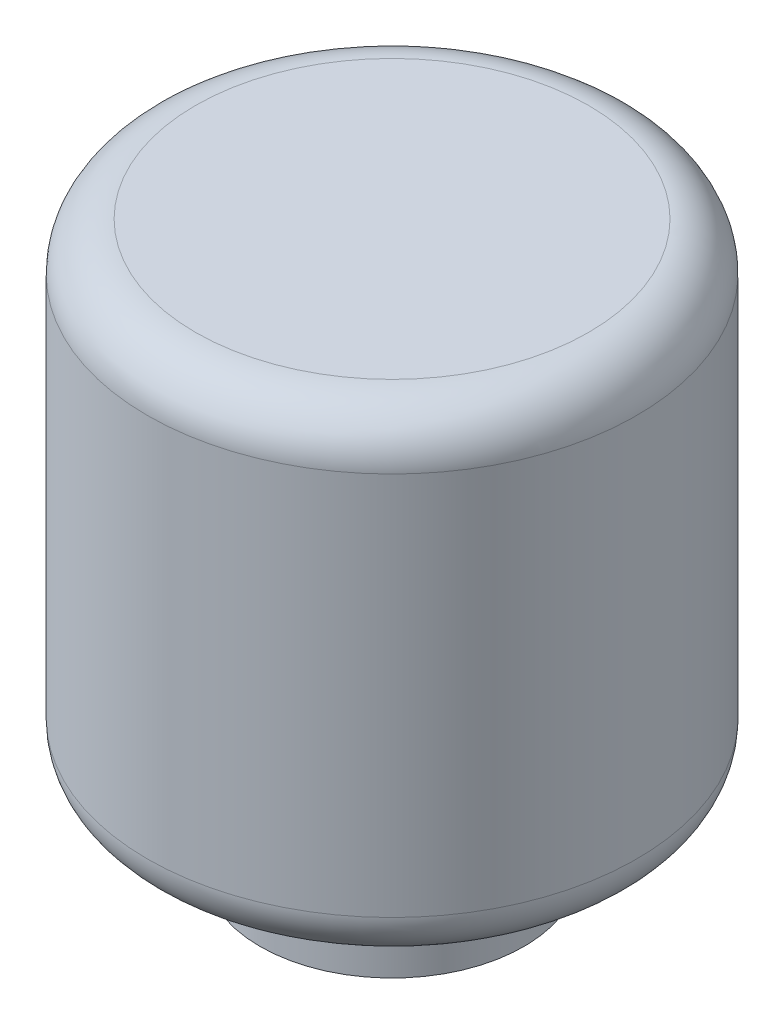
from build123d import *

# Parameters (mm, degrees)
SKETCH_1_R      = 5.5
EXTRUDE_1_DEPTH = 1.5
SKETCH_2_R      = 2.5
EXTRUDE_2_DEPTH = 2
SKETCH_3_R      = 10.188778254
EXTRUDE_3_DEPTH = 20
FILLET_2_R      = 2
FILLET_3_R      = 2
SCALE_1_SCALE   = 1.703703703


with BuildPart() as part:
    # 草图1 → 凸台-拉伸1 (new body)
    with BuildSketch(Plane(origin=(0, 0, 0), x_dir=(1, 0, 0), z_dir=(0, 1, 0))):
        with Locations(Location((0, 0, 0), (0, 0, 270))):
            Circle(SKETCH_1_R)
    extrude(amount=EXTRUDE_1_DEPTH)

    # 草图2 → 凸台-拉伸2 (add)
    with BuildSketch(Plane(origin=(0, 1.5, 0), x_dir=(1, 0, 0), z_dir=(0, 1, 0))):
        with Locations(Location((0, 0, 0), (0, 0, 270))):
            Circle(SKETCH_2_R)
    extrude(amount=EXTRUDE_2_DEPTH)

    # 草图3 → 凸台-拉伸3 (add)
    with BuildSketch(Plane(origin=(0, 3.5, 0), x_dir=(1, 0, 0), z_dir=(0, 1, 0))):
        with Locations(Location((0, 0, 0), (0, 0, 270))):
            Circle(SKETCH_3_R)
    extrude(amount=EXTRUDE_3_DEPTH)

    # 圆角2
    fillet_2_edges = [part.edges().sort_by_distance(p)[0] for p in [
        (0, 23.5, -10.188778254),
    ]]
    fillet(fillet_2_edges, radius=FILLET_2_R)

    # 圆角3
    fillet_3_edges = [part.edges().sort_by_distance(p)[0] for p in [
        (0, 3.5, -2.5),
        (0, 3.5, -10.188778254),
    ]]
    fillet(fillet_3_edges, radius=FILLET_3_R - 0.0001)  # a hair under: the kernel refuses the full size


with BuildPart() as part_1:
    # 缩放比例1: scaled about (0, 13.134921616, 0)
    add(part.part.scale(SCALE_1_SCALE).moved(Location((0, -9.243092979, 0))))


solid = part_1.part
